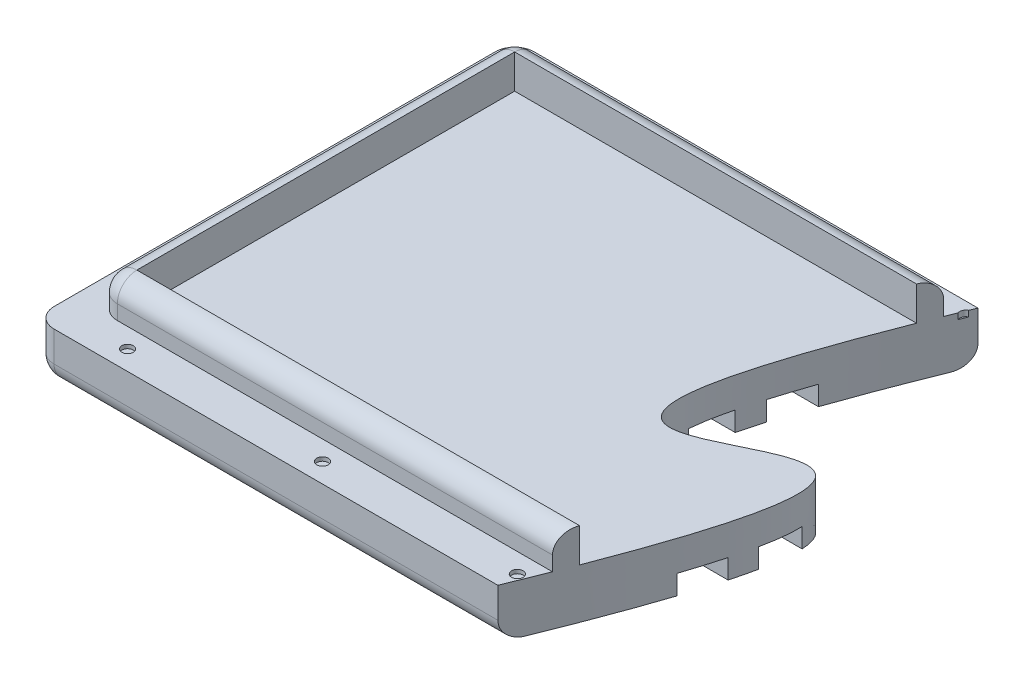
from build123d import *

# Parameters (mm, degrees)
SKETCH1_14_W         = 241.554
SKETCH1_14_H         = 125.149549896
BOSS_EXTRUDE9_DEPTH  = 3.81
SKETCH1_W            = 241.554
SKETCH1_H            = 125.149549896
SKETCH1_W_2          = 228.854
SKETCH1_H_2          = 108.639549896
BOSS_EXTRUDE10_DEPTH = 9.171821007
SKETCH29_R           = 1.61811024
CUT_EXTRUDE12_DEPTH  = 1.5
LPATTERN24_COUNT     = 3
LPATTERN24_PITCH     = 50.8
LPATTERN25_COUNT     = 3
LPATTERN25_PITCH     = 50.8
SKETCH30_R           = 1.5
CUT_EXTRUDE13_DEPTH  = 1
LPATTERN26_COUNT     = 3
LPATTERN26_PITCH     = 50.8
LPATTERN27_COUNT     = 3
LPATTERN27_PITCH     = 50.8
SKETCH37_W           = 228.854
SKETCH37_H           = 108.639549896
BOSS_EXTRUDE12_DEPTH = 18.034
FILLET7_R            = 5.08
SKETCH38_W           = 218.694
SKETCH38_H           = 98.479549896
CUT_EXTRUDE14_DEPTH  = 8.862178993
CUT_EXTRUDE15_DEPTH  = 5.08
SURFACECUT1_START    = -3.81
SURFACECUT1_DEPTH    = 21.844


# Read off the part's stored shape, not the designer's step: SurfaceCut1
with BuildPart() as part:
    # Sketch1<14> → Boss-Extrude9 (new body)
    with BuildSketch(Plane(origin=(0, 0, 0), x_dir=(1, 0, 0), z_dir=(0, 1, 0))):
        with Locations((0, -1.905)):
            Rectangle(SKETCH1_14_W, SKETCH1_14_H)
    extrude(amount=-BOSS_EXTRUDE9_DEPTH)

    # Sketch1 → Boss-Extrude10 (add)
    with BuildSketch(Plane(origin=(0, 0, 0), x_dir=(1, 0, 0), z_dir=(0, 1, 0))):
        with Locations((0, -1.905)):
            Rectangle(SKETCH1_W, SKETCH1_H)
        Rectangle(SKETCH1_W_2, SKETCH1_H_2, mode=Mode.SUBTRACT)
    extrude(amount=BOSS_EXTRUDE10_DEPTH)

    # Sketch29 → Cut-Extrude12 (cut)
    with BuildSketch(Plane(origin=(0, 9.171821007, 0), x_dir=(1, 0, 0), z_dir=(0, 1, 0))):
        with Locations(Location((0, 57.494774948, 0), (0, 0, 270))):
            Circle(SKETCH29_R)
    cut_extrude12 = extrude(amount=-CUT_EXTRUDE12_DEPTH, mode=Mode.SUBTRACT)

    # LPattern24: Cut-Extrude12 ×3
    with Locations(*[(-i * LPATTERN24_PITCH, 0, 0) for i in range(1, LPATTERN24_COUNT)]):
        add(cut_extrude12, mode=Mode.SUBTRACT)

    # LPattern25: Cut-Extrude12 ×3
    with Locations(*[(i * LPATTERN25_PITCH, 0, 0) for i in range(1, LPATTERN25_COUNT)]):
        add(cut_extrude12, mode=Mode.SUBTRACT)

    # Sketch30 → Cut-Extrude13 (cut)
    with BuildSketch(Plane(origin=(0, 9.171821007, 0), x_dir=(1, 0, 0), z_dir=(0, 1, 0))):
        with Locations(Location((0, -59.399774948, 0), (0, 0, 270))):
            Circle(SKETCH30_R)
    cut_extrude13 = extrude(amount=-CUT_EXTRUDE13_DEPTH, mode=Mode.SUBTRACT)

    # LPattern26: Cut-Extrude13 ×3
    with Locations(*[(i * LPATTERN26_PITCH, 0, 0) for i in range(1, LPATTERN26_COUNT)]):
        add(cut_extrude13, mode=Mode.SUBTRACT)

    # LPattern27: Cut-Extrude13 ×3
    with Locations(*[(-i * LPATTERN27_PITCH, 0, 0) for i in range(1, LPATTERN27_COUNT)]):
        add(cut_extrude13, mode=Mode.SUBTRACT)

    # Sketch37 → Boss-Extrude12 (add)
    with BuildSketch(Plane(origin=(0, 0, 0), x_dir=(1, 0, 0), z_dir=(0, 1, 0))):
        Rectangle(SKETCH37_W, SKETCH37_H)
    extrude(amount=BOSS_EXTRUDE12_DEPTH)

    # Fillet7
    fillet7_edges = [part.edges().sort_by_distance(p)[0] for p in [
        (120.777, -3.81, 1.905),
        (0, -3.81, -60.669774948),
        (-120.777, -3.81, 1.905),
        (0, -3.81, 64.479774948),
        (-120.777, 2.680910504, -60.669774948),
        (-114.427, 13.602910504, -54.319774948),
        (120.777, 2.680910504, -60.669774948),
        (-114.427, 13.602910504, 54.319774948),
        (114.427, 13.602910504, 54.319774948),
        (114.427, 13.602910504, -54.319774948),
        (-114.427, 18.034, 0),
        (0, 18.034, 54.319774948),
        (114.427, 18.034, 0),
        (120.777, 2.680910504, 64.479774948),
        (0, 18.034, -54.319774948),
        (-120.777, 2.680910504, 64.479774948),
    ]]
    fillet(fillet7_edges, radius=FILLET7_R)

    # Sketch38 → Cut-Extrude14 (cut)
    with BuildSketch(Plane(origin=(0, 18.034, 0), x_dir=(1, 0, 0), z_dir=(0, 1, 0))):
        Rectangle(SKETCH38_W, SKETCH38_H)
    extrude(amount=-CUT_EXTRUDE14_DEPTH, mode=Mode.SUBTRACT)

    # Sketch40 → Cut-Extrude15 (cut)
    with BuildSketch(Plane.XZ.offset(3.81)):
        Polygon((-35.878101968, 30.590802731), (120.777, 30.590802731), (120.777, 20.320819759), (-25.608118996, 20.320819759), (-25.608118996, 13.474164444), (-4.307413572, 13.474164444), (-4.307413572, 3.204181472), (-25.608118996, 3.204181472), (-25.608118996, -3.642473843), (-4.307413572, -3.642473843), (-4.307413572, -13.912456815), (-35.878101968, -13.912456815), align=None)
        Polygon((35.878101968, -3.204181472), (12.295330254, -3.204181472), (12.295330254, 3.642473843), (35.878101968, 3.642473843), (35.878101968, 13.912456815), (2.025195134, 13.912456815), (2.025195134, -13.474164444), (25.608118996, -13.474164444), (25.608118996, -20.320667611), (-120.777, -20.320667611), (-120.777, -30.590802731), (35.878101968, -30.590802731), align=None)
    extrude(amount=-CUT_EXTRUDE15_DEPTH, mode=Mode.SUBTRACT)

    # SurfaceCut1 outline → SurfaceCut1 (cut)
    with BuildSketch(Plane(origin=(0, 0, 0), x_dir=(1, 0, 0), z_dir=(0, 1, 0)).offset(SURFACECUT1_START)):
        with BuildLine():
            Line((0, -64.479774948), (115.697, -64.479774948))
            ThreePointArc((115.697, -64.479774948), (119.289102448, -62.991877396), (120.777, -59.399774948))
            Line((120.777, -59.399774948), (120.777, 55.589774948))
            ThreePointArc((120.777, 55.589774948), (119.289102448, 59.181877396), (115.697, 60.669774948))
            Line((115.697, 60.669774948), (0, 60.669774948))
            add(Edge.make_bspline(
                [(0, 60.669774948), (-4.900958952, 48.738988323), (-8.678459932, 38.81495371), (-11.504191584, 30.590802731)],
                knots=[0.996302642, 0.996302642, 0.996302642, 0.996302642, 1.072713483, 1.072713483, 1.072713483, 1.072713483], degree=3))
            add(Edge.make_bspline(
                [(-11.504191584, 30.590802731), (-18.142241768, 11.271088885), (-19.527974886, 1.332143628), (-17.887110358, -3.204181472)],
                knots=[0.888553663, 0.888553663, 0.888553663, 0.888553663, 1.068053721, 1.068053721, 1.068053721, 1.068053721], degree=3))
            add(Edge.make_bspline(
                [(-17.887110358, -3.204181472), (-11.085165947, -22.008799781), (47.725405996, 52.02444551), (0, -64.479774948)],
                knots=[0.478911773, 0.478911773, 0.478911773, 0.478911773, 1.223000875, 1.223000875, 1.223000875, 1.223000875], degree=3))
        make_face()
    extrude(amount=SURFACECUT1_DEPTH, mode=Mode.SUBTRACT)


solid = part.part
